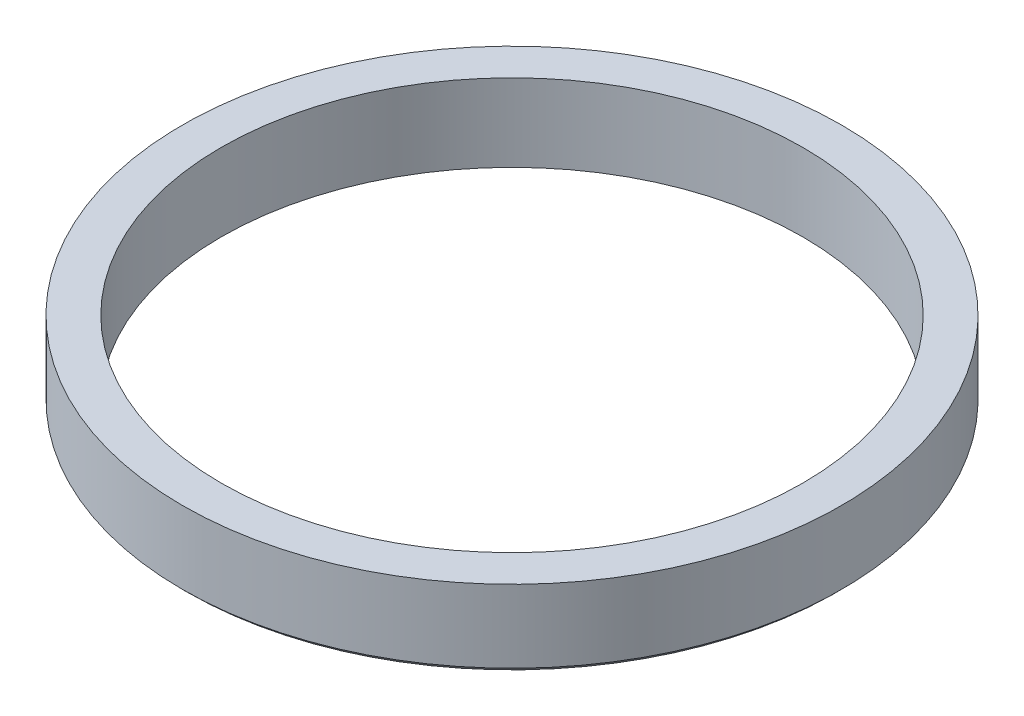
from build123d import *

# Parameters (mm, degrees)
SCHIZZO1_W   = 8
SCHIZZO1_H   = 16
SMUSSO1_SIZE = 1


with BuildPart() as part:
    # Schizzo1 → Rivoluzione1 (revolve)
    with BuildSketch(Plane.XY):
        with Locations((-64, 8)):
            Rectangle(SCHIZZO1_W, SCHIZZO1_H)
    revolve(axis=Axis((0, 0, 0), (0, 1, 0)))

    # Smusso1
    smusso1_edges = [part.edges().sort_by_distance(p)[0] for p in [
        (68, 0, 0),
    ]]
    chamfer(smusso1_edges, length=SMUSSO1_SIZE)


solid = part.part
